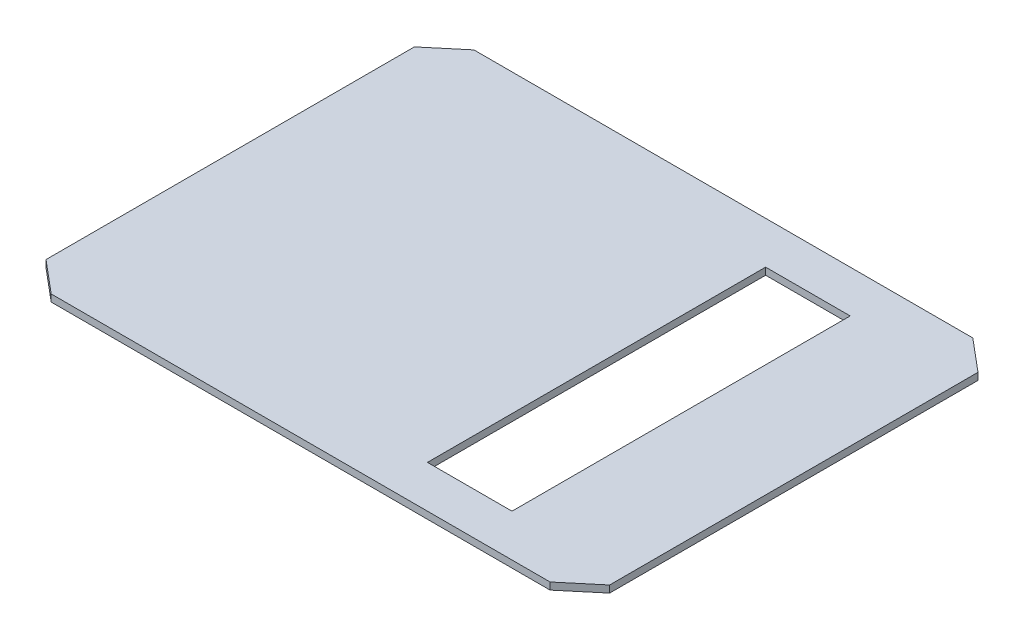
from build123d import *

# Parameters (mm, degrees)
BOSS_EXTRUDE1_DEPTH = 3.175
SKETCH2_W           = 38.1
SKETCH2_H           = 152.4
CUT_EXTRUDE1_DEPTH  = 159.781746826


with BuildPart() as part:
    # Sketch1 → Boss-Extrude1 (new body)
    with BuildSketch(Plane(origin=(0, 0, 0), x_dir=(1, 0, 0), z_dir=(0, 1, 0))):
        Polygon((112.406853359, -95.25), (127, -83.004896035), (127, 83.004896035), (112.406853359, 95.25), (-112.406853359, 95.25), (-127, 83.004896035), (-127, -83.004896035), (-112.406853359, -95.25), align=None)
    extrude(amount=BOSS_EXTRUDE1_DEPTH)

    # Sketch2 → Cut-Extrude1 (cut, through all)
    with BuildSketch(Plane(origin=(0, 3.175, 0), x_dir=(1, 0, 0), z_dir=(0, 1, 0))):
        with Locations((57.15, 0)):
            Rectangle(SKETCH2_W, SKETCH2_H)
    extrude(amount=-CUT_EXTRUDE1_DEPTH, mode=Mode.SUBTRACT)


solid = part.part
